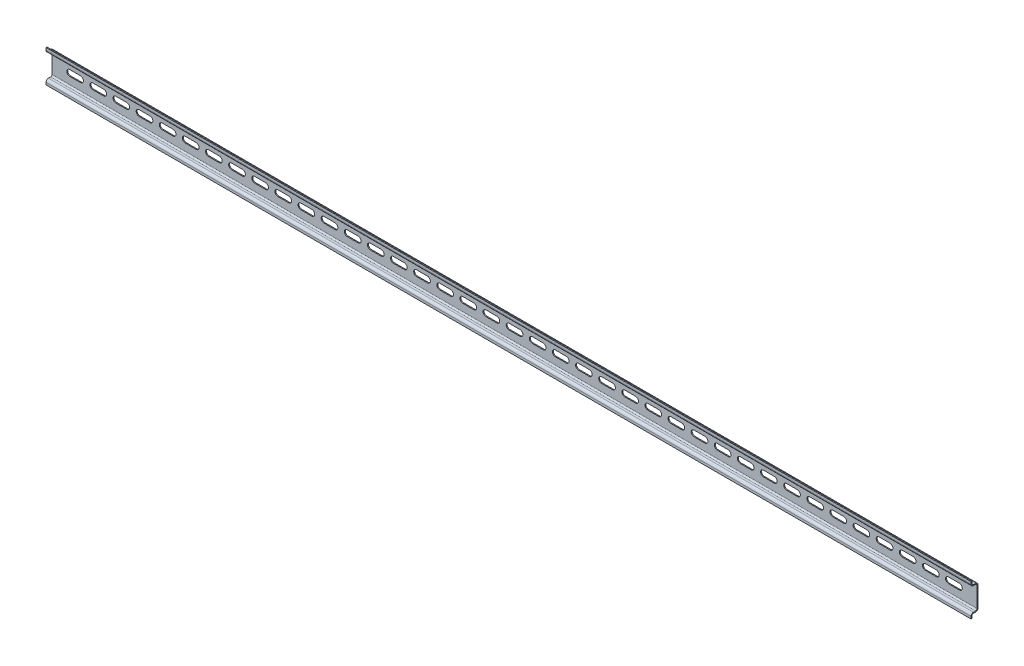
from build123d import *

# Parameters (mm, degrees)
BOSS_EXTRUDE1_DEPTH = 1000
CUT_EXTRUDE1_DEPTH  = 1001.181688833
FILLET1_R           = 2.54
FILLET2_R           = 1.524


with BuildPart() as part:
    # Sketch1 → Boss-Extrude1 (new body)
    with BuildSketch(Plane(origin=(0, 0, 0), x_dir=(0, 0, -1), z_dir=(1, 0, 0))):
        Polygon((0, 12.446), (0, -12.446), (-6.484, -12.446), (-6.484, -17.526), (-5.484, -17.526), (-5.484, -13.462), (1.016, -13.462), (1.016, 13.462), (-5.484, 13.462), (-5.484, 17.526), (-6.484, 17.526), (-6.484, 12.446), align=None)
    extrude(amount=BOSS_EXTRUDE1_DEPTH)

    # Sketch2 → Cut-Extrude1 (cut, through all)
    with BuildSketch(Plane(origin=(0, 0, -1.016), x_dir=(-1, 0, 0), z_dir=(0, 0, -1))):
        with BuildLine():
            Line((-980.825, 3.175), (-969.175, 3.175))
            ThreePointArc((-969.175, 3.175), (-966, 0), (-969.175, -3.175))
            Line((-969.175, -3.175), (-980.825, -3.175))
            ThreePointArc((-980.825, -3.175), (-984, 0), (-980.825, 3.175))
        make_face()
        with BuildLine():
            Line((-955.824999962, 3.175), (-944.174999962, 3.175))
            ThreePointArc((-944.174999962, 3.175), (-940.999999962, 0), (-944.174999962, -3.175))
            Line((-944.174999962, -3.175), (-955.824999962, -3.175))
            ThreePointArc((-955.824999962, -3.175), (-958.999999962, 0), (-955.824999962, 3.175))
        make_face()
        with BuildLine():
            Line((-930.824999924, 3.175), (-919.174999924, 3.175))
            ThreePointArc((-919.174999924, 3.175), (-915.999999924, 0), (-919.174999924, -3.175))
            Line((-919.174999924, -3.175), (-930.824999924, -3.175))
            ThreePointArc((-930.824999924, -3.175), (-933.999999924, 0), (-930.824999924, 3.175))
        make_face()
        with BuildLine():
            Line((-905.824999886, 3.175), (-894.174999886, 3.175))
            ThreePointArc((-894.174999886, 3.175), (-890.999999886, 0), (-894.174999886, -3.175))
            Line((-894.174999886, -3.175), (-905.824999886, -3.175))
            ThreePointArc((-905.824999886, -3.175), (-908.999999886, 0), (-905.824999886, 3.175))
        make_face()
        with BuildLine():
            Line((-880.824999848, 3.175), (-869.174999848, 3.175))
            ThreePointArc((-869.174999848, 3.175), (-865.999999848, 0), (-869.174999848, -3.175))
            Line((-869.174999848, -3.175), (-880.824999848, -3.175))
            ThreePointArc((-880.824999848, -3.175), (-883.999999848, 0), (-880.824999848, 3.175))
        make_face()
        with BuildLine():
            Line((-855.82499981, 3.175), (-844.17499981, 3.175))
            ThreePointArc((-844.17499981, 3.175), (-840.99999981, 0), (-844.17499981, -3.175))
            Line((-844.17499981, -3.175), (-855.82499981, -3.175))
            ThreePointArc((-855.82499981, -3.175), (-858.99999981, 0), (-855.82499981, 3.175))
        make_face()
        with BuildLine():
            Line((-830.824999772, 3.175), (-819.174999772, 3.175))
            ThreePointArc((-819.174999772, 3.175), (-815.999999772, 0), (-819.174999772, -3.175))
            Line((-819.174999772, -3.175), (-830.824999772, -3.175))
            ThreePointArc((-830.824999772, -3.175), (-833.999999772, 0), (-830.824999772, 3.175))
        make_face()
        with BuildLine():
            Line((-805.824999734, 3.175), (-794.174999734, 3.175))
            ThreePointArc((-794.174999734, 3.175), (-790.999999734, 0), (-794.174999734, -3.175))
            Line((-794.174999734, -3.175), (-805.824999734, -3.175))
            ThreePointArc((-805.824999734, -3.175), (-808.999999734, 0), (-805.824999734, 3.175))
        make_face()
        with BuildLine():
            Line((-780.824999696, 3.175), (-769.174999696, 3.175))
            ThreePointArc((-769.174999696, 3.175), (-765.999999696, 0), (-769.174999696, -3.175))
            Line((-769.174999696, -3.175), (-780.824999696, -3.175))
            ThreePointArc((-780.824999696, -3.175), (-783.999999696, 0), (-780.824999696, 3.175))
        make_face()
        with BuildLine():
            Line((-755.824999658, 3.175), (-744.174999658, 3.175))
            ThreePointArc((-744.174999658, 3.175), (-740.999999658, 0), (-744.174999658, -3.175))
            Line((-744.174999658, -3.175), (-755.824999658, -3.175))
            ThreePointArc((-755.824999658, -3.175), (-758.999999658, 0), (-755.824999658, 3.175))
        make_face()
        with BuildLine():
            Line((-730.82499962, 3.175), (-719.17499962, 3.175))
            ThreePointArc((-719.17499962, 3.175), (-715.99999962, 0), (-719.17499962, -3.175))
            Line((-719.17499962, -3.175), (-730.82499962, -3.175))
            ThreePointArc((-730.82499962, -3.175), (-733.99999962, 0), (-730.82499962, 3.175))
        make_face()
        with BuildLine():
            Line((-705.824999582, 3.175), (-694.174999582, 3.175))
            ThreePointArc((-694.174999582, 3.175), (-690.999999582, 0), (-694.174999582, -3.175))
            Line((-694.174999582, -3.175), (-705.824999582, -3.175))
            ThreePointArc((-705.824999582, -3.175), (-708.999999582, 0), (-705.824999582, 3.175))
        make_face()
        with BuildLine():
            Line((-680.824999544, 3.175), (-669.174999544, 3.175))
            ThreePointArc((-669.174999544, 3.175), (-665.999999544, 0), (-669.174999544, -3.175))
            Line((-669.174999544, -3.175), (-680.824999544, -3.175))
            ThreePointArc((-680.824999544, -3.175), (-683.999999544, 0), (-680.824999544, 3.175))
        make_face()
        with BuildLine():
            Line((-655.824999506, 3.175), (-644.174999506, 3.175))
            ThreePointArc((-644.174999506, 3.175), (-640.999999506, 0), (-644.174999506, -3.175))
            Line((-644.174999506, -3.175), (-655.824999506, -3.175))
            ThreePointArc((-655.824999506, -3.175), (-658.999999506, 0), (-655.824999506, 3.175))
        make_face()
        with BuildLine():
            Line((-630.824999468, 3.175), (-619.174999468, 3.175))
            ThreePointArc((-619.174999468, 3.175), (-615.999999468, 0), (-619.174999468, -3.175))
            Line((-619.174999468, -3.175), (-630.824999468, -3.175))
            ThreePointArc((-630.824999468, -3.175), (-633.999999468, 0), (-630.824999468, 3.175))
        make_face()
        with BuildLine():
            Line((-605.82499943, 3.175), (-594.17499943, 3.175))
            ThreePointArc((-594.17499943, 3.175), (-590.99999943, 0), (-594.17499943, -3.175))
            Line((-594.17499943, -3.175), (-605.82499943, -3.175))
            ThreePointArc((-605.82499943, -3.175), (-608.99999943, 0), (-605.82499943, 3.175))
        make_face()
        with BuildLine():
            Line((-580.824999392, 3.175), (-569.174999392, 3.175))
            ThreePointArc((-569.174999392, 3.175), (-565.999999392, 0), (-569.174999392, -3.175))
            Line((-569.174999392, -3.175), (-580.824999392, -3.175))
            ThreePointArc((-580.824999392, -3.175), (-583.999999392, 0), (-580.824999392, 3.175))
        make_face()
        with BuildLine():
            Line((-555.824999354, 3.175), (-544.174999354, 3.175))
            ThreePointArc((-544.174999354, 3.175), (-540.999999354, 0), (-544.174999354, -3.175))
            Line((-544.174999354, -3.175), (-555.824999354, -3.175))
            ThreePointArc((-555.824999354, -3.175), (-558.999999354, 0), (-555.824999354, 3.175))
        make_face()
        with BuildLine():
            Line((-530.824999316, 3.175), (-519.174999316, 3.175))
            ThreePointArc((-519.174999316, 3.175), (-515.999999316, 0), (-519.174999316, -3.175))
            Line((-519.174999316, -3.175), (-530.824999316, -3.175))
            ThreePointArc((-530.824999316, -3.175), (-533.999999316, 0), (-530.824999316, 3.175))
        make_face()
        with BuildLine():
            Line((-505.824999278, 3.175), (-494.174999278, 3.175))
            ThreePointArc((-494.174999278, 3.175), (-490.999999278, 0), (-494.174999278, -3.175))
            Line((-494.174999278, -3.175), (-505.824999278, -3.175))
            ThreePointArc((-505.824999278, -3.175), (-508.999999278, 0), (-505.824999278, 3.175))
        make_face()
        with BuildLine():
            Line((-480.82499924, 3.175), (-469.17499924, 3.175))
            ThreePointArc((-469.17499924, 3.175), (-465.99999924, 0), (-469.17499924, -3.175))
            Line((-469.17499924, -3.175), (-480.82499924, -3.175))
            ThreePointArc((-480.82499924, -3.175), (-483.99999924, 0), (-480.82499924, 3.175))
        make_face()
        with BuildLine():
            Line((-455.824999202, 3.175), (-444.174999202, 3.175))
            ThreePointArc((-444.174999202, 3.175), (-440.999999202, 0), (-444.174999202, -3.175))
            Line((-444.174999202, -3.175), (-455.824999202, -3.175))
            ThreePointArc((-455.824999202, -3.175), (-458.999999202, 0), (-455.824999202, 3.175))
        make_face()
        with BuildLine():
            Line((-430.824999164, 3.175), (-419.174999164, 3.175))
            ThreePointArc((-419.174999164, 3.175), (-415.999999164, 0), (-419.174999164, -3.175))
            Line((-419.174999164, -3.175), (-430.824999164, -3.175))
            ThreePointArc((-430.824999164, -3.175), (-433.999999164, 0), (-430.824999164, 3.175))
        make_face()
        with BuildLine():
            Line((-405.824999126, 3.175), (-394.174999126, 3.175))
            ThreePointArc((-394.174999126, 3.175), (-390.999999126, 0), (-394.174999126, -3.175))
            Line((-394.174999126, -3.175), (-405.824999126, -3.175))
            ThreePointArc((-405.824999126, -3.175), (-408.999999126, 0), (-405.824999126, 3.175))
        make_face()
        with BuildLine():
            Line((-380.824999088, 3.175), (-369.174999088, 3.175))
            ThreePointArc((-369.174999088, 3.175), (-365.999999088, 0), (-369.174999088, -3.175))
            Line((-369.174999088, -3.175), (-380.824999088, -3.175))
            ThreePointArc((-380.824999088, -3.175), (-383.999999088, 0), (-380.824999088, 3.175))
        make_face()
        with BuildLine():
            Line((-355.82499905, 3.175), (-344.17499905, 3.175))
            ThreePointArc((-344.17499905, 3.175), (-340.99999905, 0), (-344.17499905, -3.175))
            Line((-344.17499905, -3.175), (-355.82499905, -3.175))
            ThreePointArc((-355.82499905, -3.175), (-358.99999905, 0), (-355.82499905, 3.175))
        make_face()
        with BuildLine():
            Line((-330.824999012, 3.175), (-319.174999012, 3.175))
            ThreePointArc((-319.174999012, 3.175), (-315.999999012, 0), (-319.174999012, -3.175))
            Line((-319.174999012, -3.175), (-330.824999012, -3.175))
            ThreePointArc((-330.824999012, -3.175), (-333.999999012, 0), (-330.824999012, 3.175))
        make_face()
        with BuildLine():
            Line((-305.824998974, 3.175), (-294.174998974, 3.175))
            ThreePointArc((-294.174998974, 3.175), (-290.999998974, 0), (-294.174998974, -3.175))
            Line((-294.174998974, -3.175), (-305.824998974, -3.175))
            ThreePointArc((-305.824998974, -3.175), (-308.999998974, 0), (-305.824998974, 3.175))
        make_face()
        with BuildLine():
            Line((-280.824998936, 3.175), (-269.174998936, 3.175))
            ThreePointArc((-269.174998936, 3.175), (-265.999998936, 0), (-269.174998936, -3.175))
            Line((-269.174998936, -3.175), (-280.824998936, -3.175))
            ThreePointArc((-280.824998936, -3.175), (-283.999998936, 0), (-280.824998936, 3.175))
        make_face()
        with BuildLine():
            Line((-255.824998898, 3.175), (-244.174998898, 3.175))
            ThreePointArc((-244.174998898, 3.175), (-240.999998898, 0), (-244.174998898, -3.175))
            Line((-244.174998898, -3.175), (-255.824998898, -3.175))
            ThreePointArc((-255.824998898, -3.175), (-258.999998898, 0), (-255.824998898, 3.175))
        make_face()
        with BuildLine():
            Line((-230.82499886, 3.175), (-219.17499886, 3.175))
            ThreePointArc((-219.17499886, 3.175), (-215.99999886, 0), (-219.17499886, -3.175))
            Line((-219.17499886, -3.175), (-230.82499886, -3.175))
            ThreePointArc((-230.82499886, -3.175), (-233.99999886, 0), (-230.82499886, 3.175))
        make_face()
        with BuildLine():
            Line((-205.824998822, 3.175), (-194.174998822, 3.175))
            ThreePointArc((-194.174998822, 3.175), (-190.999998822, 0), (-194.174998822, -3.175))
            Line((-194.174998822, -3.175), (-205.824998822, -3.175))
            ThreePointArc((-205.824998822, -3.175), (-208.999998822, 0), (-205.824998822, 3.175))
        make_face()
        with BuildLine():
            Line((-180.824998784, 3.175), (-169.174998784, 3.175))
            ThreePointArc((-169.174998784, 3.175), (-165.999998784, 0), (-169.174998784, -3.175))
            Line((-169.174998784, -3.175), (-180.824998784, -3.175))
            ThreePointArc((-180.824998784, -3.175), (-183.999998784, 0), (-180.824998784, 3.175))
        make_face()
        with BuildLine():
            Line((-155.824998746, 3.175), (-144.174998746, 3.175))
            ThreePointArc((-144.174998746, 3.175), (-140.999998746, 0), (-144.174998746, -3.175))
            Line((-144.174998746, -3.175), (-155.824998746, -3.175))
            ThreePointArc((-155.824998746, -3.175), (-158.999998746, 0), (-155.824998746, 3.175))
        make_face()
        with BuildLine():
            Line((-130.824998708, 3.175), (-119.174998708, 3.175))
            ThreePointArc((-119.174998708, 3.175), (-115.999998708, 0), (-119.174998708, -3.175))
            Line((-119.174998708, -3.175), (-130.824998708, -3.175))
            ThreePointArc((-130.824998708, -3.175), (-133.999998708, 0), (-130.824998708, 3.175))
        make_face()
        with BuildLine():
            Line((-105.82499867, 3.175), (-94.17499867, 3.175))
            ThreePointArc((-94.17499867, 3.175), (-90.99999867, 0), (-94.17499867, -3.175))
            Line((-94.17499867, -3.175), (-105.82499867, -3.175))
            ThreePointArc((-105.82499867, -3.175), (-108.99999867, 0), (-105.82499867, 3.175))
        make_face()
        with BuildLine():
            Line((-80.824998632, 3.175), (-69.174998632, 3.175))
            ThreePointArc((-69.174998632, 3.175), (-65.999998632, 0), (-69.174998632, -3.175))
            Line((-69.174998632, -3.175), (-80.824998632, -3.175))
            ThreePointArc((-80.824998632, -3.175), (-83.999998632, 0), (-80.824998632, 3.175))
        make_face()
        with BuildLine():
            Line((-55.824998594, 3.175), (-44.174998594, 3.175))
            ThreePointArc((-44.174998594, 3.175), (-40.999998594, 0), (-44.174998594, -3.175))
            Line((-44.174998594, -3.175), (-55.824998594, -3.175))
            ThreePointArc((-55.824998594, -3.175), (-58.999998594, 0), (-55.824998594, 3.175))
        make_face()
        with BuildLine():
            Line((-30.824998556, 3.175), (-19.174998556, 3.175))
            ThreePointArc((-19.174998556, 3.175), (-15.999998556, 0), (-19.174998556, -3.175))
            Line((-19.174998556, -3.175), (-30.824998556, -3.175))
            ThreePointArc((-30.824998556, -3.175), (-33.999998556, 0), (-30.824998556, 3.175))
        make_face()
    extrude(amount=-CUT_EXTRUDE1_DEPTH, mode=Mode.SUBTRACT)

    # Fillet1
    fillet1_edges = [part.edges().sort_by_distance(p)[0] for p in [
        (500, -12.446, 6.484),
        (500, 12.446, 6.484),
        (500, -13.462, -1.016),
        (500, 13.462, -1.016),
    ]]
    fillet(fillet1_edges, radius=FILLET1_R)

    # Fillet2
    fillet2_edges = [part.edges().sort_by_distance(p)[0] for p in [
        (500, -13.462, 5.484),
        (500, 12.446, 0),
        (500, -12.446, 0),
        (500, 13.462, 5.484),
    ]]
    fillet(fillet2_edges, radius=FILLET2_R)


solid = part.part
